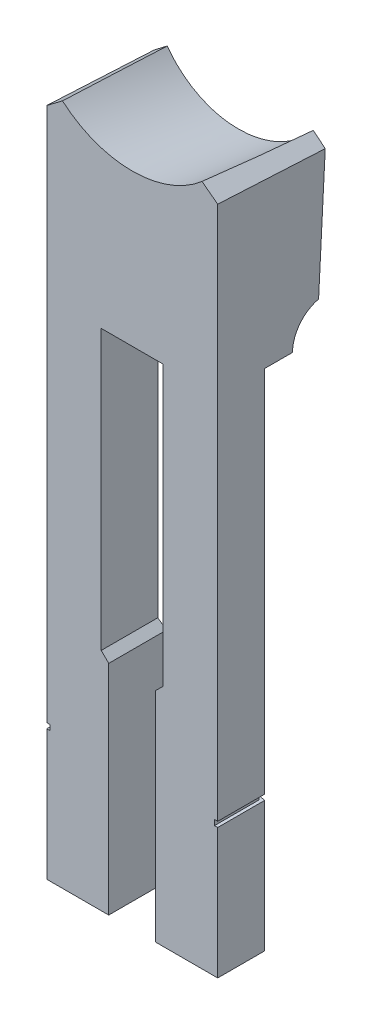
from build123d import *

# Parameters (mm, degrees)
EXTRUDE_1_DEPTH     = 80
CUT_EXTRUDE_1_DEPTH = 338.16811987
CUT_EXTRUDE_4_DEPTH = 258.724089853
EXTRUDE_2_DEPTH     = 236
SKETCH_8_W          = 29
SKETCH_8_H          = 45.03
CUT_EXTRUDE_5_DEPTH = 333.864316987
SKETCH_11_W         = 1.5
SKETCH_11_H         = 2.5
SKETCH_12_R         = 1.5
CUT_EXTRUDE_6_DEPTH = 53


with BuildPart() as part:
    # Эскиз1 → Бобышка-Вытянуть1 (new body)
    with BuildSketch(Plane(origin=(0, 0, 0), x_dir=(0, 0, -1), z_dir=(1, 0, 0))):
        with BuildLine():
            Line((0, 0), (0, 324))
            Line((0, 324), (51, 324))
            Line((51, 324), (47.202681995, 251.542856107))
            ThreePointArc((47.202681995, 251.542856107), (38.415146245, 245.880357077), (35, 236))
            Line((35, 236), (22, 236))
            Line((22, 236), (22, 0))
            Line((22, 0), (0, 0))
        make_face()
    extrude(amount=-EXTRUDE_1_DEPTH)

    # Вырез-По сечениям1: read off the stored shape, not the designer's step
    # Вырез-По сечениям1: loft between two sections, ruled curve by curve
    loft_1_from = [
        Edge.make_bspline([(-39.686086493, 386.998880194, -51), (-41.519373167, 387.011959923, -51), (-43.469191145, 386.912155262, -51), (-47.589656467, 386.390203752, -51), (-49.760899046, 385.967798341, -51), (-54.275759928, 384.685843196, -51), (-56.619984777, 383.82558407, -51), (-61.376492683, 381.5486416, -51), (-63.789033826, 380.130665414, -51), (-68.507360794, 376.644239105, -51), (-70.812489477, 374.574106824, -51), (-74.008903802, 370.963867661, -51), (-75.030367598, 369.677012554, -51), (-76.951946734, 366.944587811, -51), (-77.851980564, 365.498997396, -51), (-79.497654124, 362.465678388, -51), (-80.243201605, 360.877958795, -51), (-81.549913197, 357.585657318, -51), (-82.110987295, 355.881119395, -51), (-83.024607662, 352.388377038, -51), (-83.377081555, 350.600250078, -51), (-83.857698345, 346.979610705, -51), (-83.985800464, 345.147200182, -51), (-84.011959923, 341.480626833, -51), (-83.910016471, 339.646575032, -51), (-83.481109456, 336.019446589, -51), (-83.154185214, 334.226472409, -51), (-82.290493812, 330.721049679, -51), (-81.753797915, 329.008679629, -51), (-80.494195327, 325.69806858, -51), (-79.771378013, 324.099872821, -51), (-78.169152689, 321.043381421, -51), (-77.289836791, 319.585096094, -51), (-75.407440689, 316.825531587, -51), (-74.404442283, 315.524232794, -51), (-71.259865805, 311.868753328, -51), (-68.984509326, 309.765941211, -51), (-64.316408519, 306.212546688, -51), (-61.924345268, 304.76029167, -51), (-57.200809972, 302.415713078, -51), (-54.869098312, 301.522093112, -51), (-50.372988531, 300.17584848, -51), (-48.207994046, 299.722505841, -51), (-44.095395614, 299.141814883, -51), (-42.147200182, 299.014199536, -51), (-38.480626833, 298.988040077, -51), (-36.530808855, 299.087844738, -51), (-32.410343533, 299.609796248, -51), (-30.239100954, 300.032201659, -51), (-25.724240072, 301.314156804, -51), (-23.380015223, 302.17441593, -51), (-18.623507317, 304.4513584, -51), (-16.210966174, 305.869334586, -51), (-11.492639206, 309.355760895, -51), (-9.187510523, 311.425893176, -51), (-5.991096198, 315.036132339, -51), (-4.969632402, 316.322987446, -51), (-3.048053266, 319.055412189, -51), (-2.148019436, 320.501002604, -51), (-0.502345876, 323.534321612, -51), (0.243201605, 325.122041205, -51), (1.549913197, 328.414342682, -51), (2.110987295, 330.118880605, -51), (3.024607662, 333.611622962, -51), (3.377081555, 335.399749922, -51), (3.857698345, 339.020389295, -51), (3.985800464, 340.852799818, -51), (4.011959923, 344.519373167, -51), (3.910016471, 346.353424968, -51), (3.481109456, 349.980553411, -51), (3.154185214, 351.773527591, -51), (2.290493812, 355.278950321, -51), (1.753797915, 356.991320371, -51), (0.494195327, 360.30193142, -51), (-0.228621987, 361.900127179, -51), (-1.830847311, 364.956618579, -51), (-2.710163209, 366.414903906, -51), (-4.592559311, 369.174468413, -51), (-5.595557717, 370.475767206, -51), (-8.740134195, 374.131246672, -51), (-11.015490674, 376.234058789, -51), (-15.683591481, 379.787453312, -51), (-18.075654732, 381.23970833, -51), (-22.799190028, 383.584286922, -51), (-25.130901688, 384.477906888, -51), (-29.627011469, 385.82415152, -51), (-31.792005954, 386.277494159, -51), (-35.904604386, 386.858185117, -51), (-37.852799818, 386.985800464, -51), (-39.686086493, 386.998880194, -51)], [0.5, 0.5, 0.5, 0.5, 0.53125, 0.53125, 0.5625, 0.5625, 0.59375, 0.59375, 0.625, 0.625, 0.65625, 0.65625, 0.671875, 0.671875, 0.6875, 0.6875, 0.703125, 0.703125, 0.71875, 0.71875, 0.734375, 0.734375, 0.75, 0.75, 0.765625, 0.765625, 0.78125, 0.78125, 0.796875, 0.796875, 0.8125, 0.8125, 0.828125, 0.828125, 0.84375, 0.84375, 0.875, 0.875, 0.90625, 0.90625, 0.9375, 0.9375, 0.96875, 0.96875, 1, 1, 1.03125, 1.03125, 1.0625, 1.0625, 1.09375, 1.09375, 1.125, 1.125, 1.15625, 1.15625, 1.171875, 1.171875, 1.1875, 1.1875, 1.203125, 1.203125, 1.21875, 1.21875, 1.234375, 1.234375, 1.25, 1.25, 1.265625, 1.265625, 1.28125, 1.28125, 1.296875, 1.296875, 1.3125, 1.3125, 1.328125, 1.328125, 1.34375, 1.34375, 1.375, 1.375, 1.40625, 1.40625, 1.4375, 1.4375, 1.46875, 1.46875, 1.5, 1.5, 1.5, 1.5], 3),
    ]
    loft_1_to = [
        Edge.make_bspline([(-40.713360954, 406.994910903, 0), (-42.796482241, 406.965187529, 0), (-45.009249926, 406.804381918, 0), (-49.677831319, 406.111186343, 0), (-52.134314987, 405.57848815, 0), (-57.232488149, 404.012258649, 0), (-59.874849492, 402.977906649, 0), (-65.223361777, 400.275392116, 0), (-67.929774494, 398.605754504, 0), (-73.205496114, 394.530069796, 0), (-75.774017529, 392.122127574, 0), (-79.317678059, 387.942789724, 0), (-80.446871791, 386.455948521, 0), (-82.56353512, 383.304901046, 0), (-83.550911607, 381.64067315, 0), (-85.346800294, 378.15448837, 0), (-86.155207908, 376.332543952, 0), (-87.559702616, 372.560371453, 0), (-88.155688516, 370.610195503, 0), (-89.108716472, 366.619860939, 0), (-89.465678189, 364.579792104, 0), (-89.923659015, 360.454683427, 0), (-90.024634276, 358.369760334, 0), (-89.965187529, 354.203517759, 0), (-89.804767323, 352.122324432, 0), (-89.229277266, 348.011962011, 0), (-88.814254578, 345.982908368, 0), (-87.74776424, 342.021389647, 0), (-87.09637946, 340.08901202, 0), (-85.584830664, 336.358447587, 0), (-84.72476929, 334.560310005, 0), (-82.830145523, 331.126783934, 0), (-81.795688029, 329.491404922, 0), (-79.589982191, 326.402031913, 0), (-78.418826302, 324.948013642, 0), (-74.757365501, 320.871483301, 0), (-72.121187465, 318.537805224, 0), (-66.731328092, 314.614304187, 0), (-63.978379853, 313.022564402, 0), (-58.5549381, 310.473751342, 0), (-55.884140832, 309.515211055, 0), (-50.743356242, 308.095077878, 0), (-48.27267393, 307.632683797, 0), (-43.586215216, 307.072972214, 0), (-41.369760334, 306.975365724, 0), (-37.203517759, 307.034812471, 0), (-34.990750074, 307.195618082, 0), (-30.322168681, 307.888813657, 0), (-27.865685013, 308.42151185, 0), (-22.767511851, 309.987741351, 0), (-20.125150508, 311.022093351, 0), (-14.776638223, 313.724607884, 0), (-12.070225506, 315.394245496, 0), (-6.794503886, 319.469930204, 0), (-4.225982471, 321.877872426, 0), (-0.682321941, 326.057210276, 0), (0.446871791, 327.544051479, 0), (2.56353512, 330.695098954, 0), (3.550911607, 332.35932685, 0), (5.346800294, 335.84551163, 0), (6.155207908, 337.667456048, 0), (7.559702616, 341.439628547, 0), (8.155688516, 343.389804497, 0), (9.108716472, 347.380139061, 0), (9.465678189, 349.420207896, 0), (9.923659015, 353.545316573, 0), (10.024634276, 355.630239666, 0), (9.965187529, 359.796482241, 0), (9.804767323, 361.877675568, 0), (9.229277266, 365.988037989, 0), (8.814254578, 368.017091632, 0), (7.74776424, 371.978610353, 0), (7.09637946, 373.91098798, 0), (5.584830664, 377.641552413, 0), (4.72476929, 379.439689995, 0), (2.830145523, 382.873216066, 0), (1.795688029, 384.508595078, 0), (-0.410017809, 387.597968087, 0), (-1.581173698, 389.051986358, 0), (-5.242634499, 393.128516699, 0), (-7.878812535, 395.462194776, 0), (-13.268671908, 399.385695813, 0), (-16.021620147, 400.977435598, 0), (-21.4450619, 403.526248658, 0), (-24.115859168, 404.484788945, 0), (-29.256643758, 405.904922122, 0), (-31.72732607, 406.367316203, 0), (-36.413784784, 406.927027786, 0), (-38.630239666, 407.024634276, 0), (-40.713360954, 406.994910903, 0)], [0.5, 0.5, 0.5, 0.5, 0.53125, 0.53125, 0.5625, 0.5625, 0.59375, 0.59375, 0.625, 0.625, 0.65625, 0.65625, 0.671875, 0.671875, 0.6875, 0.6875, 0.703125, 0.703125, 0.71875, 0.71875, 0.734375, 0.734375, 0.75, 0.75, 0.765625, 0.765625, 0.78125, 0.78125, 0.796875, 0.796875, 0.8125, 0.8125, 0.828125, 0.828125, 0.84375, 0.84375, 0.875, 0.875, 0.90625, 0.90625, 0.9375, 0.9375, 0.96875, 0.96875, 1, 1, 1.03125, 1.03125, 1.0625, 1.0625, 1.09375, 1.09375, 1.125, 1.125, 1.15625, 1.15625, 1.171875, 1.171875, 1.1875, 1.1875, 1.203125, 1.203125, 1.21875, 1.21875, 1.234375, 1.234375, 1.25, 1.25, 1.265625, 1.265625, 1.28125, 1.28125, 1.296875, 1.296875, 1.3125, 1.3125, 1.328125, 1.328125, 1.34375, 1.34375, 1.375, 1.375, 1.40625, 1.40625, 1.4375, 1.4375, 1.46875, 1.46875, 1.5, 1.5, 1.5, 1.5], 3),
    ]
    loft_1 = Solid(Shell([*[Face.make_surface_from_curves(loft_1_from[k], loft_1_to[k]) for k in range(1)], Face(Wire(loft_1_from)), Face(Wire(loft_1_to))]))
    add(loft_1, mode=Mode.SUBTRACT)

    # Эскиз5 → Вырез-Вытянуть1 (cut, through all)
    with BuildSketch(Plane(origin=(0, -1.778022863, -33.926697283), x_dir=(-1, 0, 0), z_dir=(0, -0.05233595624294387, -0.998629534754574))):
        Polygon((80, 313.151391037), (56.299680313, 331.010862926), (80, 331.010862926), align=None)
        Polygon((0, 313.151391037), (23.700319687, 331.010862926), (0, 331.010862926), align=None)
    extrude(amount=-CUT_EXTRUDE_1_DEPTH, mode=Mode.SUBTRACT)

    # Эскиз3 → Вырез-Вытянуть4 (cut, through all)
    with BuildSketch(Plane(origin=(-50, 250.794151495, -32), x_dir=(-0.9397934234884354, -0.341743063086709, -1.1856594285774567e-15), z_dir=(0, 0, -1))):
        Polygon((0, 0), (20.675455317, 7.518347388), (23.409399821, 0), (2.733944505, -7.518347388), align=None)
    cut_extrude_4 = extrude(amount=CUT_EXTRUDE_4_DEPTH, mode=Mode.SUBTRACT)

    # Зеркальное отражение1: Вырез-Вытянуть4 across plane
    add(cut_extrude_4.mirror(Plane(origin=(-40, 0, 0), x_dir=(0, 0, 1), z_dir=(1, 0, 0))), mode=Mode.SUBTRACT)

    # Эскиз6 → Бобышка-Вытянуть2 (add)
    with BuildSketch(Plane.XZ.offset(-236)):
        Polygon((0, -22), (-40, -29), (-80, -22), align=None)
    extrude(amount=EXTRUDE_2_DEPTH)

    # Вырез-По траектории1: sweep along a curve in space
    with BuildLine() as sweep_1_path:
        Line((-40, 236, 0), (-40, 206.49134077, -49.110656108))
    # Эскиз8 → Вырез-По траектории1 (sweep, cut)
    with BuildSketch(Plane.XY):
        with Locations((-40, 213.485)):
            Rectangle(SKETCH_8_W, SKETCH_8_H)
    sweep(path=sweep_1_path.line, mode=Mode.SUBTRACT)

    # Эскиз9 → Вырез-Вытянуть5 (cut, through all)
    with BuildSketch(Plane.XY):
        Polygon((-54.5, 190.97), (-25.5, 190.97), (-25.5, 105.5), (-29, 102), (-29, 0), (-51, 0), (-51, 102), (-54.5, 105.5), align=None)
    extrude(amount=-CUT_EXTRUDE_5_DEPTH, mode=Mode.SUBTRACT)

    # Вырез-По траектории4: sweep along a curve in space
    with BuildLine() as sweep_4_path:
        Line((0, 62.25, 0), (0, 62.25, -22))
        Line((0, 62.25, -22), (-29, 62.25, -27.075))
    # Эскиз11 → Вырез-По траектории4 (sweep, cut)
    with BuildSketch(Plane.XY):
        with Locations((-0.75, 62.25)):
            Rectangle(SKETCH_11_W, SKETCH_11_H)
    sweep_4 = sweep(path=sweep_4_path.line, transition=Transition.RIGHT, mode=Mode.SUBTRACT)

    # Зеркальное отражение2: Вырез-По траектории4 across plane
    add(sweep_4.mirror(Plane(origin=(-40, 0, 0), x_dir=(0, 0, 1), z_dir=(1, 0, 0))), mode=Mode.SUBTRACT)

    # Эскиз12 → Вырез-Вытянуть6 (cut)
    with BuildSketch(Plane.XZ):
        with Locations((-20, -25.5)):
            Circle(SKETCH_12_R)
        with Locations((-9, -23.575)):
            Circle(SKETCH_12_R)
        with Locations((-60, -25.5)):
            Circle(SKETCH_12_R)
        with Locations((-71, -23.575)):
            Circle(SKETCH_12_R)
    extrude(amount=-CUT_EXTRUDE_6_DEPTH, mode=Mode.SUBTRACT)


solid = part.part
